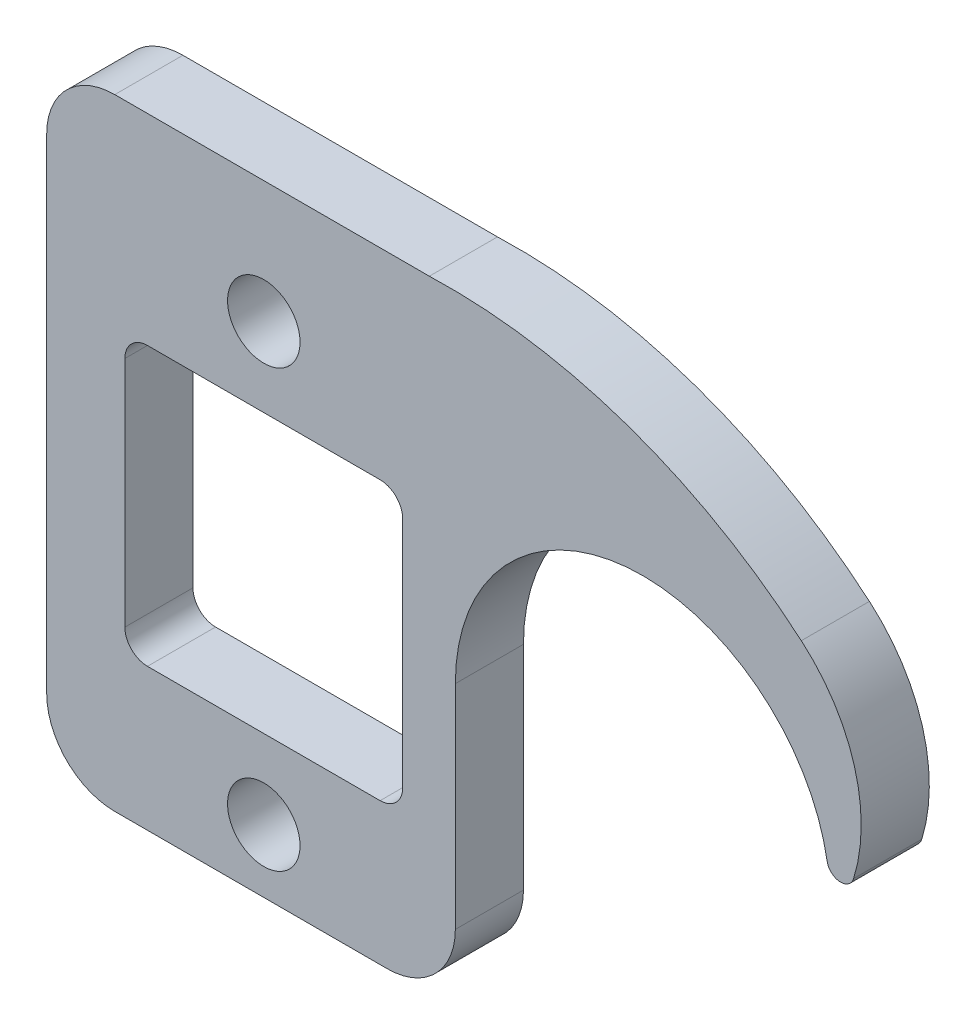
from build123d import *

# Parameters (mm, degrees)
BOSS_EXTRUDE1_DEPTH     = 3.175
FILLET1_R               = 12.7
BOSS_EXTRUDE2_START     = -3.175
BOSS_EXTRUDE2_DEPTH     = 6.35
FILLET2_R               = 2.54
CUT_EXTRUDE1_DEPTH      = 65.055934056
CUT_EXTRUDE1_DEPTH_BACK = 65.055934056
CUT_EXTRUDE2_DEPTH      = 65.291559033
CUT_EXTRUDE2_DEPTH_BACK = 65.291559033
SKETCH5_R               = 3.3782
CUT_EXTRUDE3_DEPTH      = 65.055934056
CUT_EXTRUDE3_DEPTH_BACK = 65.055934056
FILLET3_R               = 6.35
BOSS_EXTRUDE3_START     = -3.175
SKETCH8_W               = 31.56790672
SKETCH8_H               = 30.530319904
BOSS_EXTRUDE3_DEPTH     = 6.35
CUT_EXTRUDE4_DEPTH      = 65.291559033
CUT_EXTRUDE4_DEPTH_BACK = 65.291559033
BOSS_EXTRUDE4_DEPTH     = 6.35
FILLET4_R               = 6.35
BOSS_EXTRUDE5_START     = -3.175
BOSS_EXTRUDE5_DEPTH     = 6.35
FILLET5_R               = 6.35


# Read off the part's stored shape, not the designer's step: Boss-Extrude2
with BuildPart() as part:
    # Sketch1 → Boss-Extrude1 (new, symmetric)
    with BuildSketch(Plane.XY):
        with BuildLine():
            Line((-48.463583976, -13.49375), (-48.463583976, -19.84375))
            Line((-48.463583976, -19.84375), (-21.384972576, -19.84375))
            ThreePointArc((-21.384972576, -19.84375), (-15.03448736, -16.164170097), (-15.068588442, -8.824769041))
            ThreePointArc((-15.068588442, -8.824769041), (-5.999989931, 16.399360569), (17.205767985, 2.983362915))
            ThreePointArc((17.205767985, 2.983362915), (18.376051148, 1.93292337), (19.670597549, 2.825747839))
            ThreePointArc((19.670597549, 2.825747839), (15.548280342, 18.909473603), (-0.657736191, 22.52122688))
            Line((-0.657736191, 22.52122688), (-10.758192068, 19.05))
            Line((-10.758192068, 19.05), (-49.2125, 19.05))
            ThreePointArc((-49.2125, 19.05), (-53.702628061, 17.190128061), (-55.5625, 12.7))
            Line((-55.5625, 12.7), (-55.5625, 5.55625))
            Line((-55.5625, 5.55625), (-49.2125, 5.55625))
            Line((-49.2125, 5.55625), (-49.2125, 10.95375))
            ThreePointArc((-49.2125, 10.95375), (-48.468551224, 12.749801224), (-46.6725, 13.49375))
            Line((-46.6725, 13.49375), (-22.225, 13.49375))
            Line((-22.225, 13.49375), (-21.43125, 13.49375))
            Line((-21.43125, 13.49375), (-21.43125, -13.49375))
            Line((-21.43125, -13.49375), (-48.463583976, -13.49375))
        make_face()
    extrude(amount=BOSS_EXTRUDE1_DEPTH, both=True)

    # Fillet1
    fillet1_edges = [part.edges().sort_by_distance(p)[0] for p in [
        (-10.758192068, 19.05, 0),
    ]]
    fillet(fillet1_edges, radius=FILLET1_R)

    # Boss-Extrude2 outline → Boss-Extrude2 (add)
    with BuildSketch(Plane.XY.offset(BOSS_EXTRUDE2_START)):
        with BuildLine():
            Line((-49.2125, 5.55625), (-55.5625, 5.55625))
            Line((-55.5625, 5.55625), (-55.5625, -26.19375))
            Line((-55.5625, -26.19375), (-21.43125, -26.19375))
            ThreePointArc((-21.43125, -26.19375), (-20.490985887, -22.934324715), (-19.675760175, -19.641399446))
            ThreePointArc((-19.675760175, -19.641399446), (-20.524398236, -19.792986337), (-21.384972576, -19.84375))
            Line((-21.384972576, -19.84375), (-48.463583976, -19.84375))
            Line((-48.463583976, -19.84375), (-48.463583976, -13.49375))
            Line((-48.463583976, -13.49375), (-49.2125, -13.49375))
            Line((-49.2125, -13.49375), (-49.2125, 5.55625))
        make_face()
        with BuildLine():
            ThreePointArc((14.793099056, 19.595495794), (-19.885725358, 31.685738515), (-53.651579272, 17.240602957))
            ThreePointArc((-53.651579272, 17.240602957), (-51.60933867, 18.580277578), (-49.2125, 19.05))
            Line((-49.2125, 19.05), (-12.879606699, 19.05))
            ThreePointArc((-12.879606699, 19.05), (-10.787183189, 19.223557414), (-8.751949539, 19.739486007))
            Line((-8.751949539, 19.739486007), (-0.657736191, 22.52122688))
            ThreePointArc((-0.657736191, 22.52122688), (7.455399577, 23.105907404), (14.793099056, 19.595495794))
        make_face()
    extrude(amount=BOSS_EXTRUDE2_DEPTH)

    # Fillet2
    fillet2_edges = [part.edges().sort_by_distance(p)[0] for p in [
        (-21.43125, -13.49375, 0),
        (-21.43125, 13.49375, 0),
        (-49.2125, -13.49375, 0),
    ]]
    fillet(fillet2_edges, radius=FILLET2_R)

    # Sketch4 → Cut-Extrude1 (cut, two sides: drawn at the far end of the back side and taken through both)
    with BuildSketch(Plane.XY.offset(-CUT_EXTRUDE1_DEPTH_BACK)):
        with BuildLine():
            Line((-46.751875, -13.97), (-23.891875, -13.97))
            ThreePointArc((-23.891875, -13.97), (-22.095823776, -13.226051224), (-21.351875, -11.43))
            Line((-21.351875, -11.43), (-21.351875, 11.43))
            ThreePointArc((-21.351875, 11.43), (-22.095823776, 13.226051224), (-23.891875, 13.97))
            Line((-23.891875, 13.97), (-46.751875, 13.97))
            ThreePointArc((-46.751875, 13.97), (-48.547926224, 13.226051224), (-49.291875, 11.43))
            Line((-49.291875, 11.43), (-49.291875, -11.43))
            ThreePointArc((-49.291875, -11.43), (-48.547926224, -13.226051224), (-46.751875, -13.97))
        make_face()
    extrude(amount=CUT_EXTRUDE1_DEPTH + CUT_EXTRUDE1_DEPTH_BACK, mode=Mode.SUBTRACT)

    # Sketch5 → Cut-Extrude2 (cut, two sides: drawn at the far end of the back side and taken through both)
    with BuildSketch(Plane.XY.offset(3.175).offset(-CUT_EXTRUDE2_DEPTH_BACK)):
        with Locations((-35.321875, 20.32)):
            Circle(SKETCH5_R)
        with Locations((-35.321875, -20.32)):
            Circle(SKETCH5_R)
    extrude(amount=CUT_EXTRUDE2_DEPTH + CUT_EXTRUDE2_DEPTH_BACK, mode=Mode.SUBTRACT)

    # Sketch7 → Cut-Extrude3 (cut, two sides: drawn at the far end of the back side and taken through both)
    with BuildSketch(Plane.XY.offset(-CUT_EXTRUDE3_DEPTH_BACK)):
        with BuildLine():
            Line((-17.4625, 0), (-2.652365742, -16.184067646))
            Line((-2.652365742, -16.184067646), (-21.43125, -26.19375))
            ThreePointArc((-21.43125, -26.19375), (-18.465662393, -13.245543577), (-17.4625, 0))
        make_face()
    extrude(amount=CUT_EXTRUDE3_DEPTH + CUT_EXTRUDE3_DEPTH_BACK, mode=Mode.SUBTRACT)

    # Fillet3
    fillet3_edges = [part.edges().sort_by_distance(p)[0] for p in [
        (-21.43125, -26.19375, 0),
        (-55.5625, -26.19375, 0),
    ]]
    fillet(fillet3_edges, radius=FILLET3_R)

    # Sketch8 → Boss-Extrude3 (add)
    with BuildSketch(Plane.XY.offset(BOSS_EXTRUDE3_START)):
        with Locations((-35.321875, 0)):
            Rectangle(SKETCH8_W, SKETCH8_H)
    extrude(amount=BOSS_EXTRUDE3_DEPTH)

    # Sketch10 → Cut-Extrude4 (cut, two sides: drawn at the far end of the back side and taken through both)
    with BuildSketch(Plane.XY.offset(3.175).offset(-CUT_EXTRUDE4_DEPTH_BACK)):
        with BuildLine():
            Line((-46.167675, -12.954), (-24.476075, -12.954))
            ThreePointArc((-24.476075, -12.954), (-22.985352484, -12.336522516), (-22.367875, -10.8458))
            Line((-22.367875, -10.8458), (-22.367875, 10.8458))
            ThreePointArc((-22.367875, 10.8458), (-22.985352484, 12.336522516), (-24.476075, 12.954))
            Line((-24.476075, 12.954), (-46.167675, 12.954))
            ThreePointArc((-46.167675, 12.954), (-47.658397516, 12.336522516), (-48.275875, 10.8458))
            Line((-48.275875, 10.8458), (-48.275875, -10.8458))
            ThreePointArc((-48.275875, -10.8458), (-47.658397516, -12.336522516), (-46.167675, -12.954))
        make_face()
    extrude(amount=CUT_EXTRUDE4_DEPTH + CUT_EXTRUDE4_DEPTH_BACK, mode=Mode.SUBTRACT)

    # Sketch11 → Boss-Extrude4 (add)
    with BuildSketch(Plane.XY.offset(3.175)):
        Polygon((-17.4625, 0), (-17.4625, -26.19375), (-26.250928218, -26.19375), align=None)
    extrude(amount=-BOSS_EXTRUDE4_DEPTH)

    # Fillet4
    fillet4_edges = [part.edges().sort_by_distance(p)[0] for p in [
        (-17.4625, -26.19375, 0),
    ]]
    fillet(fillet4_edges, radius=FILLET4_R)

    # Sketch12 → Boss-Extrude5 (add)
    with BuildSketch(Plane.XY.offset(BOSS_EXTRUDE5_START)):
        with BuildLine():
            Line((-19.885725358, 31.685738515), (-55.5625, 31.685738515))
            Line((-55.5625, 31.685738515), (-55.5625, 12.7))
            ThreePointArc((-55.5625, 12.7), (-39.066914618, 24.716176008), (-19.885725358, 31.685738515))
        make_face()
    extrude(amount=BOSS_EXTRUDE5_DEPTH)

    # Fillet5
    fillet5_edges = [part.edges().sort_by_distance(p)[0] for p in [
        (-55.5625, 31.685738515, 0),
    ]]
    fillet(fillet5_edges, radius=FILLET5_R)


solid = part.part
